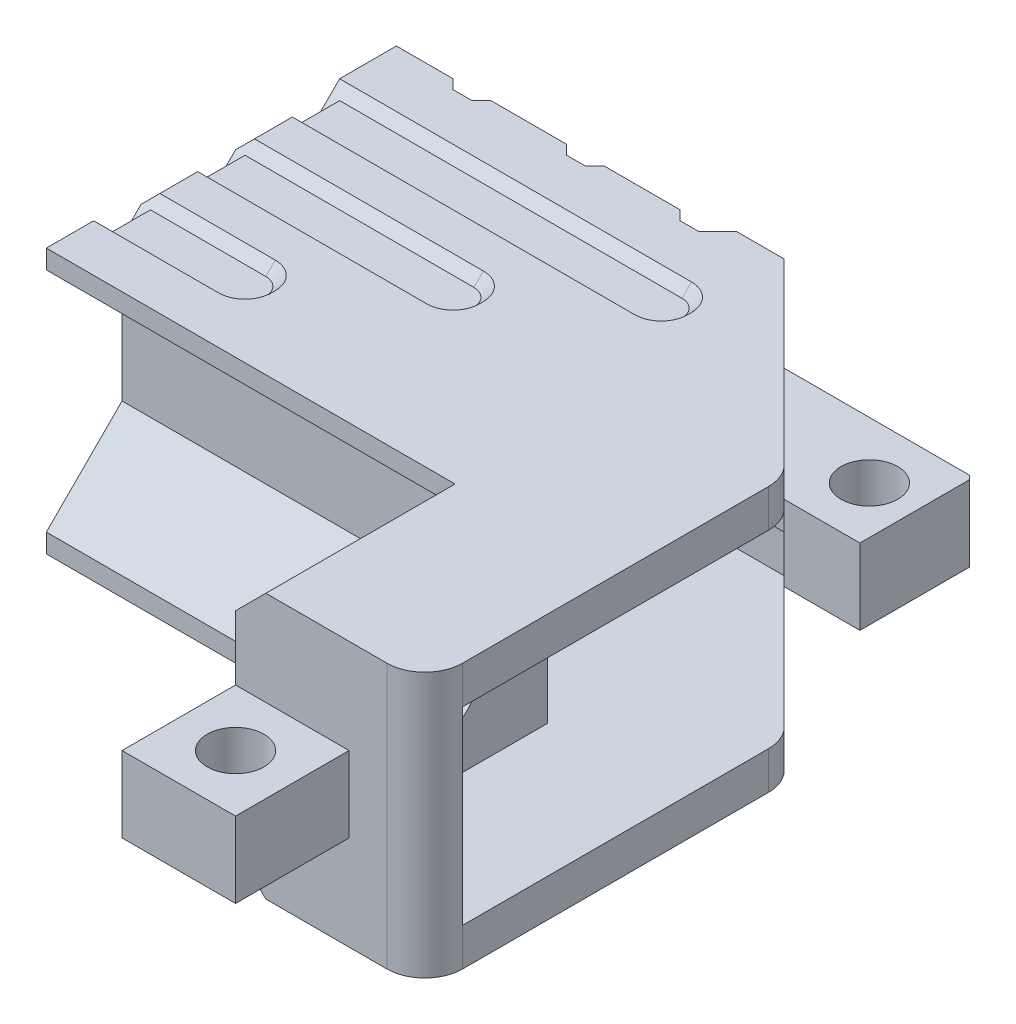
from build123d import *

# Parameters (mm, degrees)
EXTRUDE_1_DEPTH     = 14
CUT_EXTRUDE_1_DEPTH = 3
CHAMFER_1_SIZE      = 1.6
EXTRUDE_START       = -5
SKETCH_3_W          = 6
SKETCH_3_H          = 6
EXTRUDE_3_DEPTH     = 4
CUT_EXTRUDE_2_DEPTH = 3.4
CUT_EXTRUDE_START   = -2
CUT_EXTRUDE_3_DEPTH = 10
EXTRUDE_4_DEPTH     = 4
CHAMFER_2_SIZE      = 3
SKETCH_7_R          = 1.5
CUT_EXTRUDE_4_DEPTH = 39.678159212
CHAMFER_3_SIZE      = 0.2
CUT_EXTRUDE_5_DEPTH = 39.678159212
CHAMFER_5_SIZE      = 0.5
EXTRUDE_5_DEPTH     = 22
CUT_EXTRUDE_6_DEPTH = 0.5
CUT_EXTRUDE_START_2 = -13.5
CUT_EXTRUDE_7_DEPTH = 0.5
SKETCH_13_R         = 5.4
SKETCH_13_R_2       = 5
CUT_EXTRUDE_8_DEPTH = 0.4
CHAMFER_7_SIZE      = 0.4
CHAMFER_8_SIZE      = 0.5
CHAMFER_6_SIZE      = 0.5
CHAMFER_9_SIZE      = 0.4
FILLET_1_R          = 2


# Some blends are built 0.0001 mm under size
with BuildPart() as part:
    # 草图1 → 凸台-拉伸1 (new body)
    with BuildSketch(Plane(origin=(0, 0, 0), x_dir=(1, 0, 0), z_dir=(0, 1, 0))):
        Polygon((20, 15), (30, 5), (30, -14), (20, -14), (20, 0), (0, 0), (0, 15), align=None)
    extrude(amount=EXTRUDE_1_DEPTH)

    # 草图2 → 切除-拉伸1 (cut)
    with BuildSketch(Plane.ZY.offset(-20)):
        with BuildLine():
            Line((4.2, 5.450806662), (4.2, 8.549193338))
            ThreePointArc((4.2, 8.549193338), (10.2, 7), (4.2, 5.450806662))
        make_face()
    extrude(amount=-CUT_EXTRUDE_1_DEPTH, mode=Mode.SUBTRACT)

    # 倒角1
    chamfer_1_edges = [part.edges().sort_by_distance(p)[0] for p in [
        (20, 14, 7),
        (20, 0, 7),
    ]]
    chamfer(chamfer_1_edges, length=CHAMFER_1_SIZE)

    # 草图3 → 凸台-拉伸3 (add)
    with BuildSketch(Plane(origin=(0, 14, 0), x_dir=(1, 0, 0), z_dir=(0, 1, 0)).offset(EXTRUDE_START)):
        with Locations((23, -17)):
            Rectangle(SKETCH_3_W, SKETCH_3_H)
    extrude(amount=-EXTRUDE_3_DEPTH)

    # 草图4 → 切除-拉伸2 (cut)
    with BuildSketch(Plane.ZY):
        with BuildLine():
            Line((-10.3, 5.450806662), (-10.3, 8.549193338))
            ThreePointArc((-10.3, 8.549193338), (-4.3, 7), (-10.3, 5.450806662))
        make_face()
    extrude(amount=-CUT_EXTRUDE_2_DEPTH, mode=Mode.SUBTRACT)

    # 草图5 → 切除-拉伸3 (cut)
    with BuildSketch(Plane(origin=(0, 14, 0), x_dir=(1, 0, 0), z_dir=(0, 1, 0)).offset(CUT_EXTRUDE_START)):
        Polygon((3, 2.5), (23, 2.5), (23, -12), (30, -12), (30, 12.5), (3, 12.5), align=None)
    extrude(amount=-CUT_EXTRUDE_3_DEPTH, mode=Mode.SUBTRACT)

    # 草图6 → 凸台-拉伸4 (add)
    with BuildSketch(Plane(origin=(0, 14, 0), x_dir=(1, 0, 0), z_dir=(0, 1, 0)).offset(EXTRUDE_START)):
        Polygon((23.5, 11.5), (19, 11.5), (18, 12.5), (22.5, 12.5), (20, 15), (30, 15), (30, 9), (26, 9), align=None)
    extrude(amount=-EXTRUDE_4_DEPTH)

    # 倒角2
    chamfer_2_edges = [part.edges().sort_by_distance(p)[0] for p in [
        (23, 7, -2.5),
    ]]
    chamfer(chamfer_2_edges, length=CHAMFER_2_SIZE)

    # 草图7 → 切除-拉伸4 (cut, through all)
    with BuildSketch(Plane(origin=(0, 14, 0), x_dir=(1, 0, 0), z_dir=(0, 1, 0))):
        with Locations(Location((27.5, 12, 0), (0, 0, 270))):
            Circle(SKETCH_7_R)
        with Locations(Location((23, -17, 0), (0, 0, 270))):
            Circle(SKETCH_7_R)
    extrude(amount=-CUT_EXTRUDE_4_DEPTH, mode=Mode.SUBTRACT)

    # 倒角3
    chamfer_3_edges = [part.edges().sort_by_distance(p)[0] for p in [
        (30, 7, -15),
    ]]
    chamfer(chamfer_3_edges, length=CHAMFER_3_SIZE)

    # 草图8 → 切除-拉伸5 (cut, through all)
    with BuildSketch(Plane(origin=(0, 14, 0), x_dir=(1, 0, 0), z_dir=(0, 1, 0))):
        Polygon((5.5, 15), (2.5, 15), (3, 14.5), (5, 14.5), align=None)
        Polygon((11.5, 15), (8.5, 15), (9, 14.5), (11, 14.5), align=None)
        Polygon((17.5, 15), (14.5, 15), (15, 14.5), (17, 14.5), align=None)
    extrude(amount=-CUT_EXTRUDE_5_DEPTH, mode=Mode.SUBTRACT)

    # 倒角5
    chamfer_5_edges = [part.edges().sort_by_distance(p)[0] for p in [
        (4, 0, -14.5),
        (4, 14, -14.5),
        (10, 0, -14.5),
        (10, 14, -14.5),
        (16, 0, -14.5),
        (16, 14, -14.5),
    ]]
    chamfer(chamfer_5_edges, length=CHAMFER_5_SIZE)

    # 草图15 → 凸台-拉伸5 (add)
    with BuildSketch(Plane.ZY):
        Polygon((0, 14), (4, 14), (4, 13), (0, 9), align=None)
        Polygon((0, 0), (4, 0), (4, 1), (0, 5), align=None)
    extrude(amount=-EXTRUDE_5_DEPTH)

    # 草图9 → 切除-拉伸6 (cut)
    with BuildSketch(Plane(origin=(0, 14, 0), x_dir=(1, 0, 0), z_dir=(0, 1, 0))):
        with BuildLine():
            Line((0, 3.5), (12.6, 3.5))
            ThreePointArc((12.6, 3.5), (13.589949494, 3.910050506), (14, 4.9))
            Line((14, 4.9), (14, 5.1))
            ThreePointArc((14, 5.1), (13.589949494, 6.089949494), (12.6, 6.5))
            Line((12.6, 6.5), (0, 6.5))
            Line((0, 6.5), (0, 3.5))
        make_face()
        with BuildLine():
            Line((0, 8.5), (18.6, 8.5))
            ThreePointArc((18.6, 8.5), (19.589949494, 8.910050506), (20, 9.9))
            Line((20, 9.9), (20, 10.1))
            ThreePointArc((20, 10.1), (19.589949494, 11.089949494), (18.6, 11.5))
            Line((18.6, 11.5), (0, 11.5))
            Line((0, 11.5), (0, 8.5))
        make_face()
        with BuildLine():
            Line((0, -1.5), (6.6, -1.5))
            ThreePointArc((6.6, -1.5), (7.589949494, -1.089949494), (8, -0.1))
            Line((8, -0.1), (8, 0.1))
            ThreePointArc((8, 0.1), (7.589949494, 1.089949494), (6.6, 1.5))
            Line((6.6, 1.5), (0, 1.5))
            Line((0, 1.5), (0, -1.5))
        make_face()
    extrude(amount=-CUT_EXTRUDE_6_DEPTH, mode=Mode.SUBTRACT)

    # 草图9<2> → 切除-拉伸7 (cut)
    with BuildSketch(Plane(origin=(0, 14, 0), x_dir=(1, 0, 0), z_dir=(0, 1, 0)).offset(CUT_EXTRUDE_START_2)):
        with BuildLine():
            Line((0, 3.5), (12.6, 3.5))
            ThreePointArc((12.6, 3.5), (13.589949494, 3.910050506), (14, 4.9))
            Line((14, 4.9), (14, 5.1))
            ThreePointArc((14, 5.1), (13.589949494, 6.089949494), (12.6, 6.5))
            Line((12.6, 6.5), (0, 6.5))
            Line((0, 6.5), (0, 3.5))
        make_face()
        with BuildLine():
            Line((0, 8.5), (18.6, 8.5))
            ThreePointArc((18.6, 8.5), (19.589949494, 8.910050506), (20, 9.9))
            Line((20, 9.9), (20, 10.1))
            ThreePointArc((20, 10.1), (19.589949494, 11.089949494), (18.6, 11.5))
            Line((18.6, 11.5), (0, 11.5))
            Line((0, 11.5), (0, 8.5))
        make_face()
        with BuildLine():
            Line((0, -1.5), (6.6, -1.5))
            ThreePointArc((6.6, -1.5), (7.589949494, -1.089949494), (8, -0.1))
            Line((8, -0.1), (8, 0.1))
            ThreePointArc((8, 0.1), (7.589949494, 1.089949494), (6.6, 1.5))
            Line((6.6, 1.5), (0, 1.5))
            Line((0, 1.5), (0, -1.5))
        make_face()
    extrude(amount=-CUT_EXTRUDE_7_DEPTH, mode=Mode.SUBTRACT)

    # 草图13 → 切除-拉伸8 (cut)
    with BuildSketch(Plane.ZY):
        with Locations((-7.5, 7)):
            Circle(SKETCH_13_R)
        with Locations((-7.5, 7)):
            Circle(SKETCH_13_R_2, mode=Mode.SUBTRACT)
    extrude(amount=-CUT_EXTRUDE_8_DEPTH, mode=Mode.SUBTRACT)

    # 倒角7
    chamfer_7_edges = [part.edges().sort_by_distance(p)[0] for p in [
        (0, 7, -12.5),
    ]]
    chamfer(chamfer_7_edges, length=CHAMFER_7_SIZE - 0.0001)  # a hair under: the kernel refuses the full size

    # 倒角8
    chamfer_8_edges = [part.edges().sort_by_distance(p)[0] for p in [
        (6.3, 13.5, -3.5),
        (13.589949494, 13.5, -3.910050506),
        (14, 13.5, -5),
        (13.589949494, 13.5, -6.089949494),
        (6.3, 13.5, -6.5),
        (9.3, 13.5, -8.5),
        (19.589949494, 13.5, -8.910050506),
        (20, 13.5, -10),
        (19.589949494, 13.5, -11.089949494),
        (9.3, 13.5, -11.5),
        (6.3, 0.5, -3.5),
        (13.589949494, 0.5, -3.910050506),
        (14, 0.5, -5),
        (13.589949494, 0.5, -6.089949494),
        (6.3, 0.5, -6.5),
        (9.3, 0.5, -8.5),
        (19.589949494, 0.5, -8.910050506),
        (20, 0.5, -10),
        (19.589949494, 0.5, -11.089949494),
        (9.3, 0.5, -11.5),
        (3.3, 0.5, 1.5),
        (7.589949494, 0.5, 1.089949494),
        (8, 0.5, 0),
        (7.589949494, 0.5, -1.089949494),
        (3.3, 0.5, -1.5),
        (3.3, 13.5, 1.5),
        (7.589949494, 13.5, 1.089949494),
        (8, 13.5, 0),
        (7.589949494, 13.5, -1.089949494),
        (3.3, 13.5, -1.5),
    ]]
    chamfer(chamfer_8_edges, length=CHAMFER_8_SIZE - 0.0001)  # a hair under: the kernel refuses the full size

    # 倒角6
    # the kernel refuses this chamfer: 0.5 mm, written as the material it takes off along each edge
    with BuildSketch(Plane(origin=(0, 0.5, -2.285941494), x_dir=(0, 1, 0), z_dir=(0, 0, 1))) as chamfer_6_piece_1_section:
        Polygon((CHAMFER_6_SIZE, 0), (0, -CHAMFER_6_SIZE), (0, 0), align=None)
    chamfer_6_piece_1 = extrude(amount=4.571882988, mode=Mode.PRIVATE)
    chamfer_6_piece_1 = split(chamfer_6_piece_1, bisect_by=Plane(origin=(0, 2.143020747, -0.642920747), z_dir=(0, -0.7071067811865476, -0.7071067811865476)), keep=Keep.TOP, mode=Mode.PRIVATE)
    chamfer_6_piece_1 = split(chamfer_6_piece_1, bisect_by=Plane(origin=(0, -0.142920747, -1.643020747), z_dir=(0, -0.7071067811865476, 0.7071067811865476)), keep=Keep.TOP, mode=Mode.PRIVATE)
    add(chamfer_6_piece_1, mode=Mode.SUBTRACT)
    with BuildSketch(Plane(origin=(0, 0, -4.785841494), x_dir=(0, 1, 0), z_dir=(0, 0, 1)), Plane(origin=(0, 0, -9.785841494), x_dir=(0, 1, 0), z_dir=(0, 0, 1))) as chamfer_6_piece_2:
        Polygon((CHAMFER_6_SIZE, 0), (0, -CHAMFER_6_SIZE), (0, 0), align=None)
    extrude(amount=4.571682988, mode=Mode.SUBTRACT)
    with BuildSketch(Plane(origin=(0, 0.5, -7.285941494), x_dir=(0, 1, 0), z_dir=(0, 0, 1))) as chamfer_6_piece_3_section:
        Polygon((CHAMFER_6_SIZE, 0), (0, -CHAMFER_6_SIZE), (0, 0), align=None)
    chamfer_6_piece_3 = extrude(amount=4.571882988, mode=Mode.PRIVATE)
    chamfer_6_piece_3 = split(chamfer_6_piece_3, bisect_by=Plane(origin=(0, 2.143020747, -5.642920747), z_dir=(0, -0.7071067811865474, -0.7071067811865477)), keep=Keep.TOP, mode=Mode.PRIVATE)
    chamfer_6_piece_3 = split(chamfer_6_piece_3, bisect_by=Plane(origin=(0, -0.142920747, -6.643020747), z_dir=(0, -0.7071067811865477, 0.7071067811865474)), keep=Keep.TOP, mode=Mode.PRIVATE)
    add(chamfer_6_piece_3, mode=Mode.SUBTRACT)
    with BuildSketch(Plane(origin=(0, 13.5, -2.285941494), x_dir=(0, -1, 0), z_dir=(0, 0, 1))) as chamfer_6_piece_4_section:
        Polygon((CHAMFER_6_SIZE, 0), (0, CHAMFER_6_SIZE), (0, 0), align=None)
    chamfer_6_piece_4 = extrude(amount=4.571882988, mode=Mode.PRIVATE)
    chamfer_6_piece_4 = split(chamfer_6_piece_4, bisect_by=Plane(origin=(0, 11.856979253, -0.642920747), z_dir=(0, 0.7071067811865474, -0.7071067811865477)), keep=Keep.TOP, mode=Mode.PRIVATE)
    chamfer_6_piece_4 = split(chamfer_6_piece_4, bisect_by=Plane(origin=(0, 14.142920747, -1.643020747), z_dir=(0, 0.7071067811865474, 0.7071067811865477)), keep=Keep.TOP, mode=Mode.PRIVATE)
    add(chamfer_6_piece_4, mode=Mode.SUBTRACT)
    with BuildSketch(Plane(origin=(0, 14, -4.785841494), x_dir=(0, -1, 0), z_dir=(0, 0, 1)), Plane(origin=(0, 14, -9.785841494), x_dir=(0, -1, 0), z_dir=(0, 0, 1))) as chamfer_6_piece_5:
        Polygon((CHAMFER_6_SIZE, 0), (0, CHAMFER_6_SIZE), (0, 0), align=None)
    extrude(amount=4.571682988, mode=Mode.SUBTRACT)
    with BuildSketch(Plane(origin=(0, 0.5, -12.285941494), x_dir=(0, 1, 0), z_dir=(0, 0, 1))) as chamfer_6_piece_6_section:
        Polygon((CHAMFER_6_SIZE, 0), (0, -CHAMFER_6_SIZE), (0, 0), align=None)
    chamfer_6_piece_6 = extrude(amount=4.571882988, mode=Mode.PRIVATE)
    chamfer_6_piece_6 = split(chamfer_6_piece_6, bisect_by=Plane(origin=(0, 2.143020747, -10.642920747), z_dir=(0, -0.7071067811865477, -0.7071067811865474)), keep=Keep.TOP, mode=Mode.PRIVATE)
    chamfer_6_piece_6 = split(chamfer_6_piece_6, bisect_by=Plane(origin=(0, -0.142920747, -11.643020747), z_dir=(0, -0.7071067811865477, 0.7071067811865474)), keep=Keep.TOP, mode=Mode.PRIVATE)
    add(chamfer_6_piece_6, mode=Mode.SUBTRACT)
    with BuildSketch(Plane(origin=(0, 13.5, -7.285941494), x_dir=(0, -1, 0), z_dir=(0, 0, 1))) as chamfer_6_piece_7_section:
        Polygon((CHAMFER_6_SIZE, 0), (0, CHAMFER_6_SIZE), (0, 0), align=None)
    chamfer_6_piece_7 = extrude(amount=4.571882988, mode=Mode.PRIVATE)
    chamfer_6_piece_7 = split(chamfer_6_piece_7, bisect_by=Plane(origin=(0, 11.856979253, -5.642920747), z_dir=(0, 0.7071067811865472, -0.7071067811865479)), keep=Keep.TOP, mode=Mode.PRIVATE)
    chamfer_6_piece_7 = split(chamfer_6_piece_7, bisect_by=Plane(origin=(0, 14.142920747, -6.643020747), z_dir=(0, 0.7071067811865476, 0.7071067811865476)), keep=Keep.TOP, mode=Mode.PRIVATE)
    add(chamfer_6_piece_7, mode=Mode.SUBTRACT)
    with BuildSketch(Plane(origin=(0, 13.5, -12.285941494), x_dir=(0, -1, 0), z_dir=(0, 0, 1))) as chamfer_6_piece_8_section:
        Polygon((CHAMFER_6_SIZE, 0), (0, CHAMFER_6_SIZE), (0, 0), align=None)
    chamfer_6_piece_8 = extrude(amount=4.571882988, mode=Mode.PRIVATE)
    chamfer_6_piece_8 = split(chamfer_6_piece_8, bisect_by=Plane(origin=(0, 14.142920747, -11.643020747), z_dir=(0, 0.7071067811865476, 0.7071067811865476)), keep=Keep.TOP, mode=Mode.PRIVATE)
    chamfer_6_piece_8 = split(chamfer_6_piece_8, bisect_by=Plane(origin=(0, 11.856979253, -10.642920747), z_dir=(0, 0.7071067811865476, -0.7071067811865476)), keep=Keep.TOP, mode=Mode.PRIVATE)
    add(chamfer_6_piece_8, mode=Mode.SUBTRACT)
    with BuildSketch(Plane(origin=(-1.285841494, 0, -15), x_dir=(0, 0, 1), z_dir=(1, 0, 0))) as chamfer_6_piece_9:
        Polygon((CHAMFER_6_SIZE, 0), (0, -CHAMFER_6_SIZE), (0, 0), align=None)
    extrude(amount=5.071682988, mode=Mode.SUBTRACT)
    with BuildSketch(Plane(origin=(10.214158506, 0, -15), x_dir=(0, 0, 1), z_dir=(1, 0, 0)), Plane(origin=(4.214158506, 0, -15), x_dir=(0, 0, 1), z_dir=(1, 0, 0))) as chamfer_6_piece_10:
        Polygon((CHAMFER_6_SIZE, 0), (0, -CHAMFER_6_SIZE), (0, 0), align=None)
    extrude(amount=5.571682988, mode=Mode.SUBTRACT)
    with BuildSketch(Plane(origin=(-1.285841494, 14, -15), x_dir=(0, 0, 1), z_dir=(1, 0, 0))) as chamfer_6_piece_11:
        Polygon((CHAMFER_6_SIZE, 0), (0, CHAMFER_6_SIZE), (0, 0), align=None)
    extrude(amount=5.071682988, mode=Mode.SUBTRACT)
    with BuildSketch(Plane(origin=(10.214158506, 14, -15), x_dir=(0, 0, 1), z_dir=(1, 0, 0)), Plane(origin=(4.214158506, 14, -15), x_dir=(0, 0, 1), z_dir=(1, 0, 0))) as chamfer_6_piece_12:
        Polygon((CHAMFER_6_SIZE, 0), (0, CHAMFER_6_SIZE), (0, 0), align=None)
    extrude(amount=5.571682988, mode=Mode.SUBTRACT)

    # 倒角9
    chamfer_9_edges = [part.edges().sort_by_distance(p)[0] for p in [
        (0, 7, -12.9),
    ]]
    chamfer(chamfer_9_edges, length=CHAMFER_9_SIZE - 0.0001)  # a hair under: the kernel refuses the full size

    # 圆角1
    fillet_1_edges = [part.edges().sort_by_distance(p)[0] for p in [
        (30, 13, -5),
        (30, 7, 14),
        (30, 1, -5),
    ]]
    fillet(fillet_1_edges, radius=FILLET_1_R - 0.0001)  # a hair under: the kernel refuses the full size


solid = part.part
